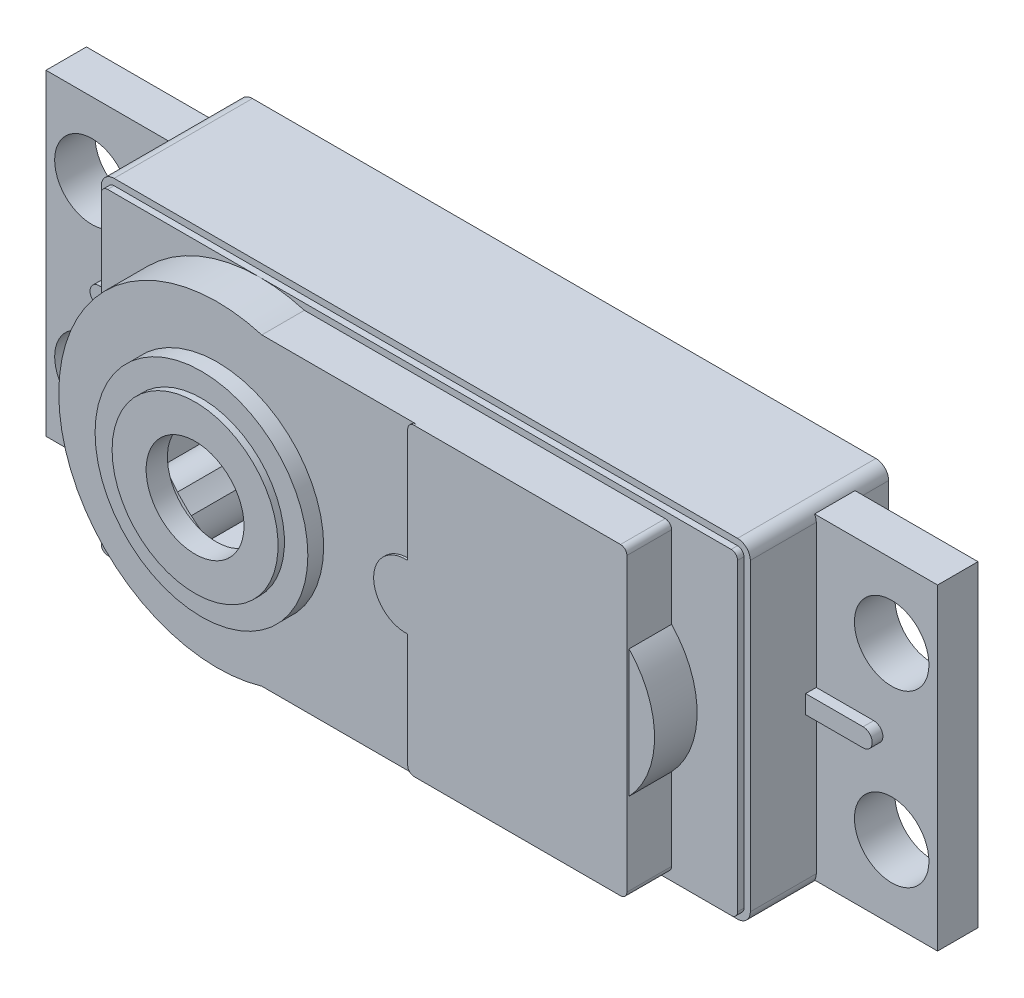
from build123d import *
from build123d.topology import SkipClean

# Parameters (mm, degrees)
EXTRUDE1_DEPTH      = 8.255
EXTRUDE2_DEPTH      = 0.381
EXTRUDE3_DEPTH      = 2.54
SKETCH7_R           = 6.35
EXTRUDE4_DEPTH      = 0.945
SKETCH8_R           = 4.953
EXTRUDE5_DEPTH      = 0.381
SHELL1_DEPTH        = 9.906
SHELL1_2_OUTLINE_W  = 36.195
SHELL1_2_OUTLINE_H  = 17.145
SHELL1_2_DEPTH      = 6.985
SHELL1_START        = 9.906
SHELL1_3_OUTLINE_R  = 5.08
SHELL1_3_DEPTH      = 0.945
SHELL1_START_2      = 6.985
SHELL1_4_DEPTH      = 0.381
SHELL1_START_3      = 10.851
SHELL1_5_OUTLINE_R  = 3.683
SHELL1_5_DEPTH      = 0.381
SKETCH28_R          = 5.08
SKETCH28_R_2        = 5
EXTRUDE14_DEPTH     = 0.945
CUT_EXTRUDE2_DEPTH  = 0.889
SKETCH12_R          = 1.905
EXTRUDE6_DEPTH      = 7.112
SKETCH9_R           = 8.89
CUT_EXTRUDE3_DEPTH  = 45.069914976
CUT_EXTRUDE5_START  = -0.381
CUT_EXTRUDE5_DEPTH  = 0.381
SKETCH14_R          = 0.79375
CUT_EXTRUDE6_DEPTH  = 6.35
EXTRUDE7_START      = -0.254
SKETCH16_W          = 2.413
SKETCH16_H          = 18.923
EXTRUDE7_DEPTH      = 7.493
EXTRUDE8_DEPTH      = 0.635
SKETCH19_R          = 2.2225
CUT_EXTRUDE7_DEPTH  = 51.67628397
EXTRUDE10_START     = 2.54
EXTRUDE10_DEPTH     = 2.54
SKETCH23_R          = 8.255
CUT_EXTRUDE10_DEPTH = 51.982710177
SKETCH24_R          = 1.905
EXTRUDE11_DEPTH     = 0.508
SKETCH25_R          = 0.79375
CUT_EXTRUDE11_DEPTH = 0.762
EXTRUDE12_START     = 0.0508
SKETCH26_R          = 5.7658
EXTRUDE12_DEPTH     = 0.0508
EXTRUDE13_DEPTH     = 0.127
SKETCH29_R          = 2.921
CUT_EXTRUDE12_DEPTH = 1.27


# Read off the part's stored shape, not the designer's step: Shell1
with BuildPart() as part:
    # Sketch2 → Extrude1 (new body)
    with BuildSketch(Plane.XY):
        with BuildLine():
            Line((0.762, 0), (37.973, 0))
            ThreePointArc((37.973, 0), (38.511815367, 0.223184633), (38.735, 0.762))
            Line((38.735, 0.762), (38.735, 18.923))
            ThreePointArc((38.735, 18.923), (38.511815367, 19.461815367), (37.973, 19.685))
            Line((37.973, 19.685), (0.762, 19.685))
            ThreePointArc((0.762, 19.685), (0.223184633, 19.461815367), (0, 18.923))
            Line((0, 18.923), (0, 0.762))
            ThreePointArc((0, 0.762), (0.223184633, 0.223184633), (0.762, 0))
        make_face()
    extrude(amount=EXTRUDE1_DEPTH)

    # Sketch4 → Extrude2 (add)
    with BuildSketch(Plane.XY.offset(8.255)):
        with BuildLine():
            Line((37.973, 19.304), (0.762, 19.304))
            ThreePointArc((0.762, 19.304), (0.492592316, 19.192407684), (0.381, 18.923))
            Line((0.381, 18.923), (0.381, 0.762))
            ThreePointArc((0.381, 0.762), (0.492592316, 0.492592316), (0.762, 0.381))
            Line((0.762, 0.381), (37.973, 0.381))
            ThreePointArc((37.973, 0.381), (38.242407684, 0.492592316), (38.354, 0.762))
            Line((38.354, 0.762), (38.354, 18.923))
            ThreePointArc((38.354, 18.923), (38.242407684, 19.192407684), (37.973, 19.304))
        make_face()
    extrude(amount=EXTRUDE2_DEPTH)

    # Sketch5 → Extrude3 (add)
    with BuildSketch(Plane.XY.offset(8.636)):
        with BuildLine():
            Line((12.500413091, 18.923), (34.036, 18.923))
            ThreePointArc((34.036, 18.923), (34.305407684, 18.811407684), (34.417, 18.542))
            Line((34.417, 18.542), (34.417, 13.6525))
            ThreePointArc((34.417, 13.6525), (35.941, 9.8425), (34.417, 6.0325))
            Line((34.417, 6.0325), (34.417, 1.143))
            ThreePointArc((34.417, 1.143), (34.305407684, 0.873592316), (34.036, 0.762))
            Line((34.036, 0.762), (12.500413091, 0.762))
            ThreePointArc((12.500413091, 0.762), (0.381, 9.8425), (12.500413091, 18.923))
        make_face()
    extrude(amount=EXTRUDE3_DEPTH)

    # Sketch7 → Extrude4 (add)
    with BuildSketch(Plane.XY.offset(11.176)):
        with Locations((9.8425, 9.8425)):
            Circle(SKETCH7_R)
    extrude(amount=EXTRUDE4_DEPTH)

    # Sketch8 → Extrude5 (add)
    with BuildSketch(Plane.XY.offset(12.121)):
        with Locations(Location((9.8425, 9.8425, 0), (0, 0, 180))):
            Circle(SKETCH8_R)
    extrude(amount=EXTRUDE5_DEPTH)

    # Shell1 outline → Shell1 (cut)
    with BuildSketch(Plane.XY):
        with BuildLine():
            ThreePointArc((12.311662206, 17.653), (1.651, 9.8425), (12.311662206, 2.032))
            Line((12.311662206, 2.032), (33.147, 2.032))
            Line((33.147, 2.032), (33.147, 6.579810925))
            ThreePointArc((33.147, 6.579810925), (34.671, 9.8425), (33.147, 13.105189075))
            Line((33.147, 13.105189075), (33.147, 17.653))
            Line((33.147, 17.653), (12.311662206, 17.653))
        make_face()
    extrude(amount=SHELL1_DEPTH, mode=Mode.SUBTRACT)

    # Shell1 2 outline → Shell1 2 (cut)
    with BuildSketch(Plane.XY):
        with Locations((19.3675, 9.8425)):
            Rectangle(SHELL1_2_OUTLINE_W, SHELL1_2_OUTLINE_H)
        with BuildLine():
            Line((12.311662206, 17.653), (33.147, 17.653))
            Line((33.147, 17.653), (33.147, 13.105189075))
            ThreePointArc((33.147, 13.105189075), (34.671, 9.8425), (33.147, 6.579810925))
            Line((33.147, 6.579810925), (33.147, 2.032))
            Line((33.147, 2.032), (12.311662206, 2.032))
            ThreePointArc((12.311662206, 2.032), (1.651, 9.8425), (12.311662206, 17.653))
        make_face(mode=Mode.SUBTRACT)
    extrude(amount=SHELL1_2_DEPTH, mode=Mode.SUBTRACT)

    # Shell1 3 outline → Shell1 3 (cut)
    with BuildSketch(Plane.XY.offset(SHELL1_START)):
        with Locations((9.8425, 9.8425)):
            Circle(SHELL1_3_OUTLINE_R)
    extrude(amount=SHELL1_3_DEPTH, mode=Mode.SUBTRACT)

    # Shell1 4 outline → Shell1 4 (cut)
    with BuildSketch(Plane.XY.offset(SHELL1_START_2)):
        with BuildLine():
            Line((9.8425, 18.034), (1.651, 18.034))
            Line((1.651, 18.034), (1.651, 9.8425))
            ThreePointArc((1.651, 9.8425), (4.050234802, 15.634765198), (9.8425, 18.034))
        make_face()
        with BuildLine():
            Line((37.084, 18.034), (9.8425, 18.034))
            ThreePointArc((9.8425, 18.034), (11.091692039, 17.938189686), (12.311662206, 17.653))
            Line((12.311662206, 17.653), (33.147, 17.653))
            Line((33.147, 17.653), (33.147, 13.105189075))
            ThreePointArc((33.147, 13.105189075), (34.671, 9.8425), (33.147, 6.579810925))
            Line((33.147, 6.579810925), (33.147, 2.032))
            Line((33.147, 2.032), (12.311662206, 2.032))
            ThreePointArc((12.311662206, 2.032), (11.091692, 1.746810308), (9.842499922, 1.651))
            Line((9.842499922, 1.651), (37.084, 1.651))
            Line((37.084, 1.651), (37.084, 18.034))
        make_face()
        with BuildLine():
            ThreePointArc((9.842499922, 1.651), (4.050234774, 4.05023483), (1.651, 9.8425))
            Line((1.651, 9.8425), (1.651, 1.651))
            Line((1.651, 1.651), (9.842499922, 1.651))
        make_face()
    extrude(amount=SHELL1_4_DEPTH, mode=Mode.SUBTRACT)

    # Shell1 5 outline → Shell1 5 (cut)
    with BuildSketch(Plane.XY.offset(SHELL1_START_3)):
        with Locations((9.8425, 9.8425)):
            Circle(SHELL1_5_OUTLINE_R)
    extrude(amount=SHELL1_5_DEPTH, mode=Mode.SUBTRACT)

    # Sketch28 → Extrude14 (add)
    with BuildSketch(Plane(origin=(0, 0, 9.906), x_dir=(-1, 0, 0), z_dir=(0, 0, -1))):
        with Locations((-9.8425, 9.8425)):
            Circle(SKETCH28_R)
        with Locations((-9.8425, 9.8425)):
            Circle(SKETCH28_R_2, mode=Mode.SUBTRACT)
    extrude(amount=-EXTRUDE14_DEPTH)

    # Sketch10 → Cut-Extrude2 (cut)
    with BuildSketch(Plane(origin=(0, 0, 0), x_dir=(-1, 0, 0), z_dir=(0, 0, -1))):
        with BuildLine():
            Line((-38.1, 18.923), (-38.1, 0.762))
            ThreePointArc((-38.1, 0.762), (-38.062802561, 0.672197439), (-37.973, 0.635))
            Line((-37.973, 0.635), (-0.762, 0.635))
            ThreePointArc((-0.762, 0.635), (-0.672197439, 0.672197439), (-0.635, 0.762))
            Line((-0.635, 0.762), (-0.635, 18.923))
            ThreePointArc((-0.635, 18.923), (-0.672197439, 19.012802561), (-0.762, 19.05))
            Line((-0.762, 19.05), (-37.973, 19.05))
            ThreePointArc((-37.973, 19.05), (-38.062802561, 19.012802561), (-38.1, 18.923))
        make_face()
    extrude(amount=-CUT_EXTRUDE2_DEPTH, mode=Mode.SUBTRACT)

    # Sketch12 → Extrude6 (add)
    with BuildSketch(Plane(origin=(0, 0, 0.889), x_dir=(-1, 0, 0), z_dir=(0, 0, -1))):
        with Locations((-2.286, 17.399)):
            Circle(SKETCH12_R)
        with Locations((-2.286, 2.286)):
            Circle(SKETCH12_R)
        with Locations((-36.449, 2.286)):
            Circle(SKETCH12_R)
        with Locations((-36.449, 17.399)):
            Circle(SKETCH12_R)
    extrude(amount=-EXTRUDE6_DEPTH)

    # Sketch9 → Cut-Extrude3 (cut, through all)
    with BuildSketch(Plane(origin=(0, 0, 7.366), x_dir=(-1, 0, 0), z_dir=(0, 0, -1))):
        with Locations((-9.8425, 9.8425)):
            Circle(SKETCH9_R)
    extrude(amount=CUT_EXTRUDE3_DEPTH, mode=Mode.SUBTRACT)

    # Sketch13 → Cut-Extrude5 (cut)
    with SkipClean():  # the faces are left unmerged after this step: merging them gives an invalid solid
        with BuildSketch(Plane(origin=(0, 0, 6.985), x_dir=(-1, 0, 0), z_dir=(0, 0, -1)).offset(CUT_EXTRUDE5_START)):
            with BuildLine():
                Line((-7.48785698, 1.27), (-3.897449348, 1.27))
                ThreePointArc((-3.897449348, 1.27), (-4.189270038, 2.204832495), (-3.978098517, 3.161115769))
                ThreePointArc((-3.978098517, 3.161115769), (-3.556320715, 3.556320715), (-3.161115769, 3.978098517))
                ThreePointArc((-3.161115769, 3.978098517), (-2.204832495, 4.189270038), (-1.27, 3.897449348))
                Line((-1.27, 3.897449348), (-1.27, 7.48785698))
                ThreePointArc((-1.27, 7.48785698), (-0.9525, 9.8425), (-1.27, 12.19714302))
                Line((-1.27, 12.19714302), (-1.27, 15.787550652))
                ThreePointArc((-1.27, 15.787550652), (-2.204832495, 15.495729962), (-3.161115769, 15.706901483))
                ThreePointArc((-3.161115769, 15.706901483), (-3.556320715, 16.128679285), (-3.978098517, 16.523884231))
                ThreePointArc((-3.978098517, 16.523884231), (-4.189270038, 17.480167505), (-3.897449348, 18.415))
                Line((-3.897449348, 18.415), (-7.48785698, 18.415))
                ThreePointArc((-7.48785698, 18.415), (-9.8425, 18.7325), (-12.19714302, 18.415))
                Line((-12.19714302, 18.415), (-34.837550652, 18.415))
                ThreePointArc((-34.837550652, 18.415), (-35.101961582, 16.051961582), (-37.465, 15.787550652))
                Line((-37.465, 15.787550652), (-37.465, 3.897449348))
                ThreePointArc((-37.465, 3.897449348), (-35.101961582, 3.633038418), (-34.837550652, 1.27))
                Line((-34.837550652, 1.27), (-12.19714302, 1.27))
                ThreePointArc((-12.19714302, 1.27), (-9.8425, 0.9525), (-7.48785698, 1.27))
            make_face()
        extrude(amount=CUT_EXTRUDE5_DEPTH, mode=Mode.SUBTRACT)

    # Sketch14 → Cut-Extrude6 (cut)
    with SkipClean():  # the faces are left unmerged after this step: merging them gives an invalid solid
        with BuildSketch(Plane(origin=(0, 0, 0.889), x_dir=(-1, 0, 0), z_dir=(0, 0, -1))):
            with Locations((-2.286, 17.399)):
                Circle(SKETCH14_R)
            with Locations((-2.286, 2.286)):
                Circle(SKETCH14_R)
            with Locations((-36.449, 2.286)):
                Circle(SKETCH14_R)
            with Locations((-36.449, 17.399)):
                Circle(SKETCH14_R)
        extrude(amount=-CUT_EXTRUDE6_DEPTH, mode=Mode.SUBTRACT)

    # Sketch16 → Extrude7 (add)
    with SkipClean():  # the faces are left unmerged after this step: merging them gives an invalid solid
        with BuildSketch(Plane(origin=(38.735, 0, 0), x_dir=(0, 0, -1), z_dir=(1, 0, 0)).offset(EXTRUDE7_START)):
            with Locations((-3.1115, 9.8425)):
                Rectangle(SKETCH16_W, SKETCH16_H)
        extrude7 = extrude(amount=EXTRUDE7_DEPTH)

    # Sketch18 → Extrude8 (add)
    with SkipClean():  # the faces are left unmerged after this step: merging them gives an invalid solid
        with BuildSketch(Plane.XY.offset(4.318)):
            with BuildLine():
                Line((38.735, 10.3886), (42.164, 10.3886))
                ThreePointArc((42.164, 10.3886), (42.7101, 9.8425), (42.164, 9.2964))
                Line((42.164, 9.2964), (38.735, 9.2964))
                Line((38.735, 9.2964), (38.735, 10.3886))
            make_face()
        extrude8 = extrude(amount=EXTRUDE8_DEPTH)

    # Sketch19 → Cut-Extrude7 (cut, through all)
    with SkipClean():  # the faces are left unmerged after this step: merging them gives an invalid solid
        with BuildSketch(Plane.XY.offset(4.318)):
            with Locations((43.235, 14.9225)):
                Circle(SKETCH19_R)
            with Locations((43.235, 4.7625)):
                Circle(SKETCH19_R)
        cut_extrude7 = extrude(amount=-CUT_EXTRUDE7_DEPTH, mode=Mode.SUBTRACT)

    # Sketch22 → Extrude10 (add)
    with SkipClean():  # the faces are left unmerged after this step: merging them gives an invalid solid
        with BuildSketch(Plane(origin=(0, 0, 9.906), x_dir=(-1, 0, 0), z_dir=(0, 0, -1)).offset(EXTRUDE10_START)):
            with BuildLine():
                Line((-12.192, 5.428901723), (-12.6746, 2.032))
                Line((-12.6746, 2.032), (-18.536713573, 2.032))
                ThreePointArc((-18.536713573, 2.032), (-15.601429485, 3.784432823), (-13.627847172, 6.575827872))
                ThreePointArc((-13.627847172, 6.575827872), (-12.963068434, 5.935832283), (-12.192, 5.428901723))
            make_face()
            with BuildLine():
                Line((-12.192, 14.256098277), (-12.6746, 17.653))
                Line((-12.6746, 17.653), (-18.536713573, 17.653))
                ThreePointArc((-18.536713573, 17.653), (-15.601429485, 15.900567177), (-13.627847172, 13.109172128))
                ThreePointArc((-13.627847172, 13.109172128), (-12.963068434, 13.749167717), (-12.192, 14.256098277))
            make_face()
        extrude(amount=-EXTRUDE10_DEPTH)

    # Sketch23 → Cut-Extrude10 (cut, through all)
    with SkipClean():  # the faces are left unmerged after this step: merging them gives an invalid solid
        with BuildSketch(Plane(origin=(0, 0, 9.906), x_dir=(-1, 0, 0), z_dir=(0, 0, -1))):
            with Locations((-21.209, 9.8425)):
                Circle(SKETCH23_R)
        extrude(amount=CUT_EXTRUDE10_DEPTH, mode=Mode.SUBTRACT)

    # Sketch24 → Extrude11 (add)
    with SkipClean():  # the faces are left unmerged after this step: merging them gives an invalid solid
        with BuildSketch(Plane(origin=(0, 0, 9.906), x_dir=(-1, 0, 0), z_dir=(0, 0, -1))):
            with Locations(Location((-21.209, 9.8425, 0), (0, 0, 180))):
                Circle(SKETCH24_R)
            with Locations(Location((-30.4165, 9.8425, 0), (0, 0, 180))):
                Circle(SKETCH24_R)
        extrude(amount=EXTRUDE11_DEPTH)

    # Sketch25 → Cut-Extrude11 (cut)
    with SkipClean():  # the faces are left unmerged after this step: merging them gives an invalid solid
        with BuildSketch(Plane(origin=(0, 0, 9.398), x_dir=(-1, 0, 0), z_dir=(0, 0, -1))):
            with Locations((-21.209, 9.8425)):
                Circle(SKETCH25_R)
            with Locations((-30.4165, 9.8425)):
                Circle(SKETCH25_R)
        extrude(amount=-CUT_EXTRUDE11_DEPTH, mode=Mode.SUBTRACT)

    # Sketch26 → Extrude12 (add)
    with SkipClean():  # the faces are left unmerged after this step: merging them gives an invalid solid
        with BuildSketch(Plane(origin=(0, 0, 9.906), x_dir=(-1, 0, 0), z_dir=(0, 0, -1)).offset(EXTRUDE12_START)):
            with Locations((-9.8425, 9.8425)):
                Circle(SKETCH26_R)
            with BuildLine():
                ThreePointArc((-13.627847172, 13.109172128), (-14.8425, 9.8425), (-13.627847172, 6.575827872))
                ThreePointArc((-13.627847172, 6.575827872), (-12.963068434, 5.935832283), (-12.192, 5.428901723))
                ThreePointArc((-12.192, 5.428901723), (-4.8425, 9.8425), (-12.192, 14.256098277))
                ThreePointArc((-12.192, 14.256098277), (-12.963068434, 13.749167717), (-13.627847172, 13.109172128))
            make_face(mode=Mode.SUBTRACT)
        extrude(amount=-EXTRUDE12_DEPTH)

    # Sketch27 → Extrude13 (add)
    with SkipClean():  # the faces are left unmerged after this step: merging them gives an invalid solid
        with BuildSketch(Plane.XY.offset(11.176)):
            with BuildLine():
                Line((21.336, 18.542), (21.336, 11.743261952))
                ThreePointArc((21.336, 11.743261952), (19.304, 9.8425), (21.336, 7.941738048))
                Line((21.336, 7.941738048), (21.336, 1.143))
                ThreePointArc((21.336, 1.143), (21.447592316, 0.873592316), (21.717, 0.762))
                Line((21.717, 0.762), (34.036, 0.762))
                ThreePointArc((34.036, 0.762), (34.305407684, 0.873592316), (34.417, 1.143))
                Line((34.417, 1.143), (34.417, 6.0325))
                Line((34.417, 6.0325), (34.417, 13.6525))
                Line((34.417, 13.6525), (34.417, 18.542))
                ThreePointArc((34.417, 18.542), (34.305407684, 18.811407684), (34.036, 18.923))
                Line((34.036, 18.923), (21.717, 18.923))
                ThreePointArc((21.717, 18.923), (21.447592316, 18.811407684), (21.336, 18.542))
            make_face()
        extrude(amount=EXTRUDE13_DEPTH)

    # Sketch29 → Cut-Extrude12 (cut)
    with SkipClean():  # the faces are left unmerged after this step: merging them gives an invalid solid
        with BuildSketch(Plane.XY.offset(12.502)):
            with Locations((9.8425, 9.8425)):
                Circle(SKETCH29_R)
        extrude(amount=-CUT_EXTRUDE12_DEPTH, mode=Mode.SUBTRACT)

    # Mirror1: Extrude7, Extrude8, Cut-Extrude7 across plane
    with SkipClean():  # the faces are left unmerged after this step: merging them gives an invalid solid
        add(extrude7.mirror(Plane.ZY.offset(-19.3675)))
        add(extrude8.mirror(Plane.ZY.offset(-19.3675)))
        add(cut_extrude7.mirror(Plane.ZY.offset(-19.3675)), mode=Mode.SUBTRACT)


solid = part.part
